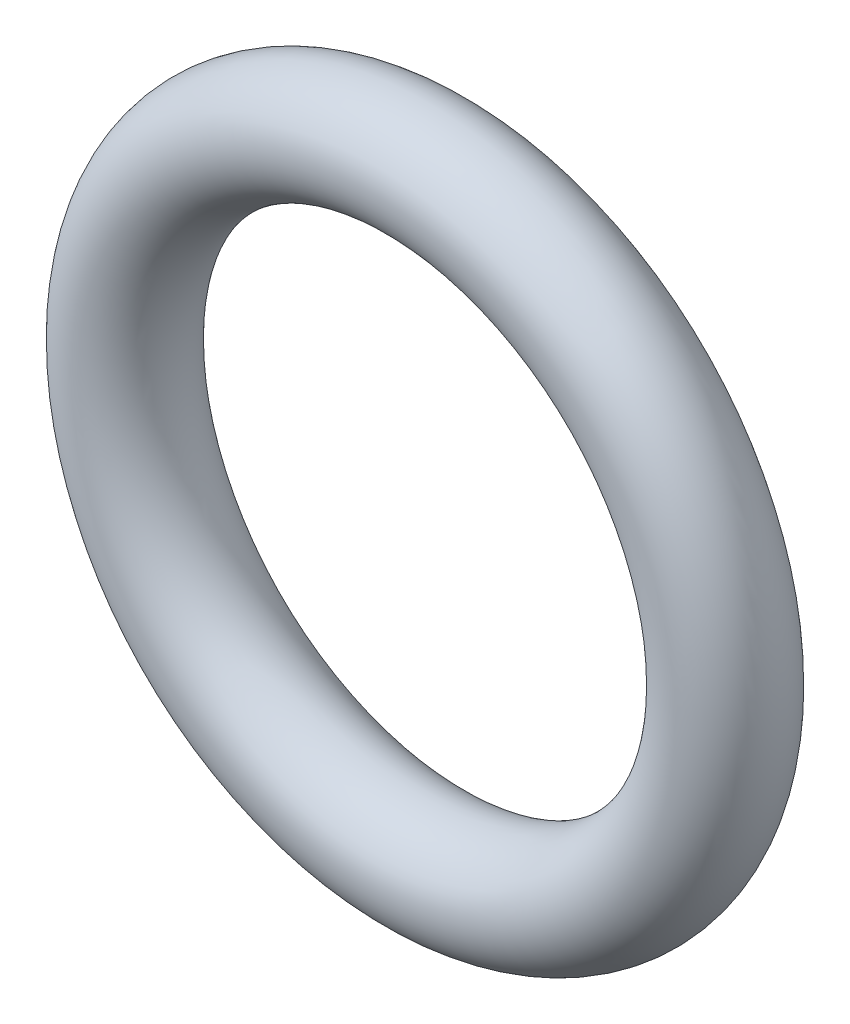
from build123d import *

# Parameters (mm, degrees)
SKETCH_1_R = 1.25


with BuildPart() as part:
    # Эскиз1 → Повернуть1 (revolve)
    with BuildSketch(Plane(origin=(0, 0, 0), x_dir=(1, 0, 0), z_dir=(0, 1, 0))):
        with Locations((6.75, 0)):
            Circle(SKETCH_1_R)
    revolve(axis=Axis((0, 0, 0), (0, 0, -1)))


solid = part.part
